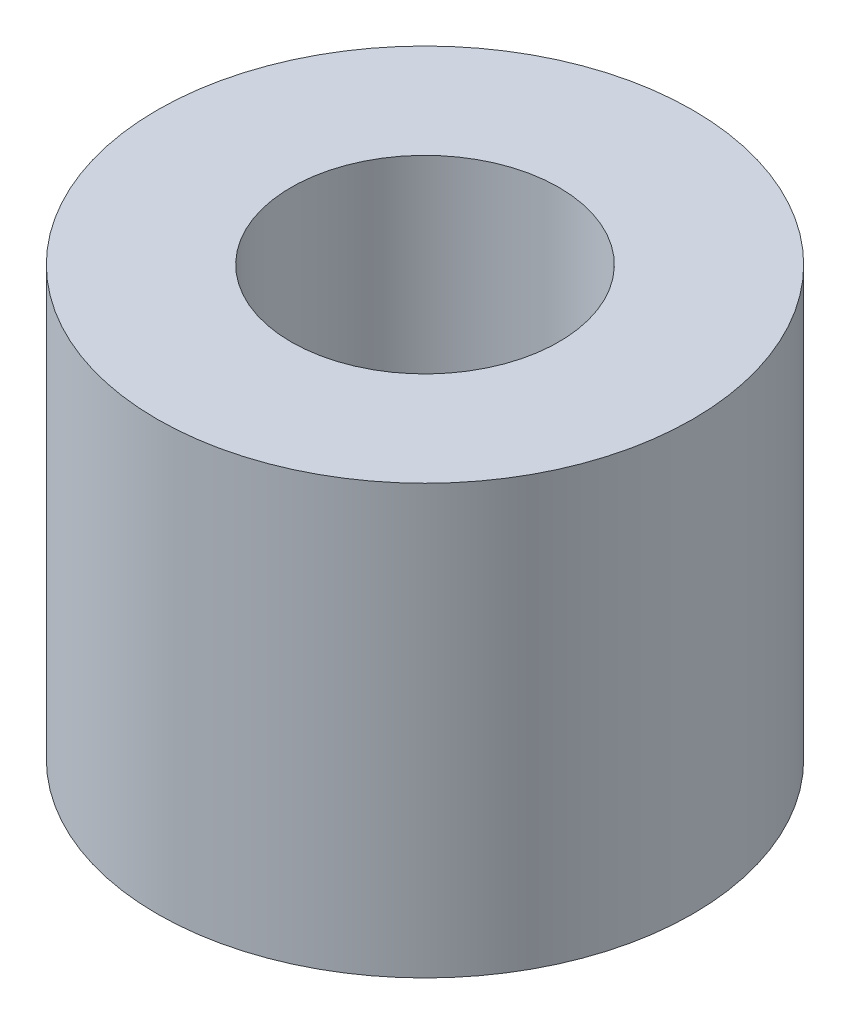
from build123d import *

# Parameters (mm, degrees)
SKETCH1_R             = 2.5
BOSS_EXTRUDE1_DEPTH   = 4
M3X0_5_TAPPED_HOLE1_D = 2.5


with BuildPart() as part:
    # Sketch1 → Boss-Extrude1 (new body)
    with BuildSketch(Plane(origin=(0, 0, 0), x_dir=(1, 0, 0), z_dir=(0, 1, 0))):
        Circle(SKETCH1_R)
    extrude(amount=BOSS_EXTRUDE1_DEPTH)

    # M3x0.5 Tapped Hole1 (through all)
    with Locations(Plane(origin=(0, 4, 0), x_dir=(1, 0, 0), z_dir=(0, 1, 0))):
        with Locations((0, 0)):
            Hole(M3X0_5_TAPPED_HOLE1_D / 2)


solid = part.part
